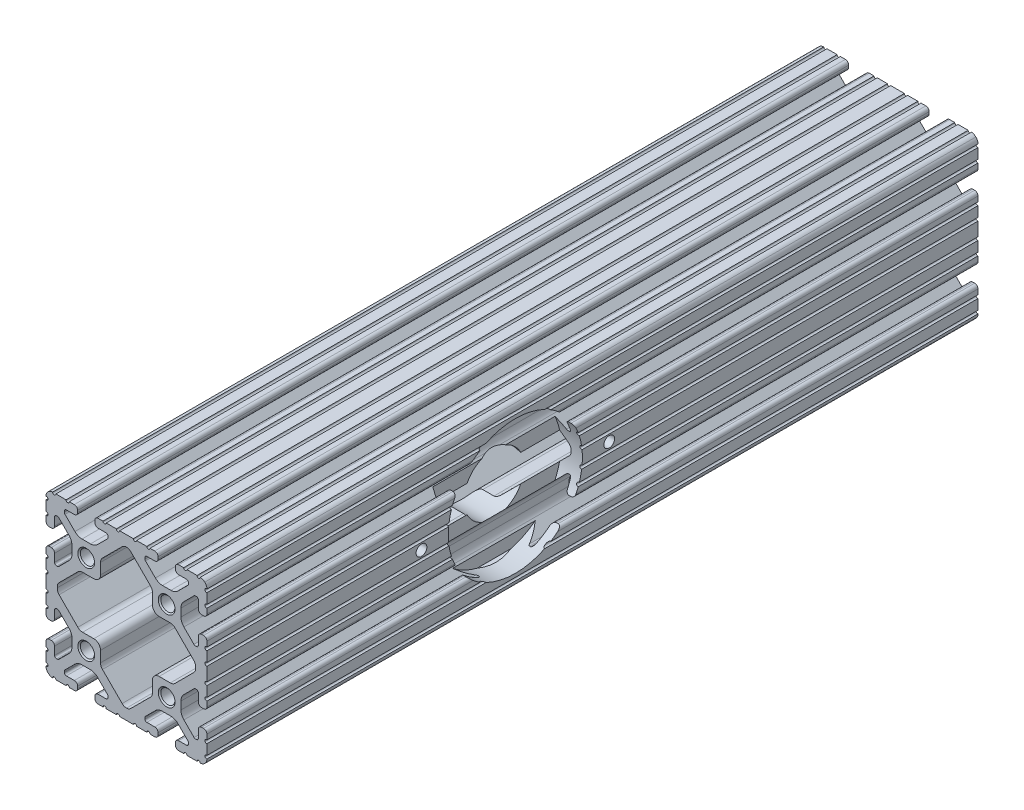
from build123d import *

# Parameters (mm, degrees)
SKETCH1_R                          = 3.3274
BOSS_EXTRUDE1_DEPTH                = 365.125
SKETCH2_R                          = 31.75
CUT_EXTRUDE1_DEPTH                 = 10.16
SKETCH3_R                          = 14.25
CUT_EXTRUDE2_DEPTH                 = 268.906799185
SKETCH4_R                          = 31.75
CUT_EXTRUDE3_DEPTH                 = 10.16
F_1_4_20_TAPPED_HOLE1_D            = 5.1054
CIRPATTERN1_COUNT                  = 2
F_5_16_18_TAPPED_HOLE1_D           = 6.5278
F_5_16_18_TAPPED_HOLE1_DEPTH       = 20.11
F_5_16_18_TAPPED_HOLE1_CSINK_D     = 7.9375
F_5_16_18_TAPPED_HOLE1_CSINK_ANGLE = 100
F_5_16_18_TAPPED_HOLE1_TIP         = 1.961148974
F_1_4_20_TAPPED_HOLE3_D            = 5.1054
LPATTERN2_COUNT                    = 2
LPATTERN2_PITCH                    = 80.3218612
LPATTERN2_COUNT_DIR2               = 2
LPATTERN2_PITCH_DIR2               = 38.1


with BuildPart() as part:
    # Sketch1 → Boss-Extrude1 (new body)
    with BuildSketch(Plane(origin=(0, 0, -254), x_dir=(-1, 0, 0), z_dir=(0, 0, -1))):
        with BuildLine():
            Line((36.525200182, -23.055396049), (35.610799999, -23.055396049))
            ThreePointArc((35.610799999, -23.055396049), (34.49724824, -23.51664429), (34.035999999, -24.630196049))
            Line((34.035999999, -24.630196049), (34.035999999, -28.448000001))
            ThreePointArc((34.035999999, -28.448000001), (33.775617927, -29.07661793), (33.146999999, -29.337000001))
            Line((33.146999999, -29.337000001), (32.664287243, -29.337000001))
            ThreePointArc((32.664287243, -29.337000001), (32.324081166, -29.269328696), (32.035668541, -29.076617157))
            Line((32.035668541, -29.076617157), (27.197580079, -24.238516795))
            ThreePointArc((27.197580079, -24.238516795), (26.167955878, -22.697572205), (25.806399999, -20.879905136))
            Line((25.806399999, -20.879905136), (25.806399999, -17.220094864))
            ThreePointArc((25.806399999, -17.220094864), (26.167955878, -15.402427795), (27.197580079, -13.861483205))
            Line((27.197580079, -13.861483205), (31.948944539, -9.110107059))
            ThreePointArc((31.948944539, -9.110107059), (32.333417094, -8.853210197), (32.786933647, -8.763000001))
            Line((32.786933647, -8.763000001), (33.060275786, -8.763000001))
            ThreePointArc((33.060275786, -8.763000001), (33.750216993, -9.048783007), (34.035999999, -9.738724214))
            Line((34.035999999, -9.738724214), (34.035999999, -13.469803585))
            ThreePointArc((34.035999999, -13.469803585), (34.497248347, -14.583355602), (35.610800365, -15.044603951))
            Line((35.610800365, -15.044603951), (36.525199999, -15.044603951))
            ThreePointArc((36.525199999, -15.044603951), (37.638751758, -14.58335571), (38.099999999, -13.469803951))
            Line((38.099999999, -13.469803951), (38.099999999, -11.075039291))
            ThreePointArc((38.099999999, -11.075039291), (37.117000249, -10.313517274), (38.099999999, -9.551995256))
            Line((38.099999999, -9.551995256), (38.099999999, -4.723759309))
            ThreePointArc((38.099999999, -4.723759309), (37.117000249, -3.962237291), (38.099999999, -3.200715274))
            Line((38.099999999, -3.200715274), (38.099999999, 3.200715274))
            ThreePointArc((38.099999999, 3.200715274), (37.117000249, 3.962237291), (38.099999999, 4.723759309))
            Line((38.099999999, 4.723759309), (38.099999999, 9.551995254))
            ThreePointArc((38.099999999, 9.551995254), (37.117000249, 10.313517271), (38.099999999, 11.075039288))
            Line((38.099999999, 11.075039288), (38.099999999, 13.469803951))
            ThreePointArc((38.099999999, 13.469803951), (37.638751758, 14.58335571), (36.525199999, 15.044603951))
            Line((36.525199999, 15.044603951), (35.610800365, 15.044603951))
            ThreePointArc((35.610800365, 15.044603951), (34.497248347, 14.583355602), (34.035999999, 13.469803585))
            Line((34.035999999, 13.469803585), (34.035999999, 9.738724211))
            ThreePointArc((34.035999999, 9.738724211), (33.750216993, 9.048783004), (33.060275786, 8.762999999))
            Line((33.060275786, 8.762999999), (32.78693365, 8.762999999))
            ThreePointArc((32.78693365, 8.762999999), (32.333417097, 8.853210195), (31.948944542, 9.110107056))
            Line((31.948944542, 9.110107056), (27.197580079, 13.861483205))
            ThreePointArc((27.197580079, 13.861483205), (26.167955878, 15.402427795), (25.806399999, 17.220094864))
            Line((25.806399999, 17.220094864), (25.806399999, 20.879905136))
            ThreePointArc((25.806399999, 20.879905136), (26.167955878, 22.697572205), (27.19758008, 24.238516796))
            Line((27.19758008, 24.238516796), (32.035668541, 29.076617154))
            ThreePointArc((32.035668541, 29.076617154), (32.324081166, 29.269328694), (32.664287243, 29.336999999))
            Line((32.664287243, 29.336999999), (33.146999999, 29.336999999))
            ThreePointArc((33.146999999, 29.336999999), (33.775617927, 29.076617927), (34.035999999, 28.447999999))
            Line((34.035999999, 28.447999999), (34.035999999, 24.630196049))
            ThreePointArc((34.035999999, 24.630196049), (34.49724824, 23.51664429), (35.610799999, 23.055396049))
            Line((35.610799999, 23.055396049), (36.525200182, 23.055396049))
            ThreePointArc((36.525200182, 23.055396049), (37.638751811, 23.516644237), (38.099999999, 24.630195866))
            Line((38.099999999, 24.630195866), (38.099999999, 27.023826138))
            ThreePointArc((38.099999999, 27.023826138), (37.117780707, 27.7845421), (38.099999999, 28.545258063))
            Line((38.099999999, 28.545258063), (38.099999999, 33.373016026))
            ThreePointArc((38.099999999, 33.373016026), (37.141472622, 34.109236775), (38.1, 34.845457522))
            ThreePointArc((38.1, 34.845457522), (37.837757798, 36.120195039), (37.086123087, 37.182631848))
            ThreePointArc((37.086123087, 37.182631848), (36.106286535, 37.843374412), (34.952681874, 38.099999999))
            ThreePointArc((34.952681874, 38.099999999), (34.190730434, 37.320215334), (33.428778993, 38.099999999))
            Line((33.428778993, 38.099999999), (28.601105934, 38.099999999))
            ThreePointArc((28.601105934, 38.099999999), (27.83915858, 37.320219419), (27.077211226, 38.099999999))
            Line((27.077211226, 38.099999999), (24.688799999, 38.099999999))
            ThreePointArc((24.688799999, 38.099999999), (23.57524824, 37.638751758), (23.113999999, 36.525199999))
            Line((23.113999999, 36.525199999), (23.113999999, 35.610799999))
            ThreePointArc((23.113999999, 35.610799999), (23.57524824, 34.49724824), (24.688799999, 34.035999999))
            Line((24.688799999, 34.035999999), (28.447999999, 34.035999999))
            ThreePointArc((28.447999999, 34.035999999), (29.076617927, 33.775617927), (29.336999999, 33.146999999))
            Line((29.336999999, 33.146999999), (29.336999999, 32.720693457))
            ThreePointArc((29.336999999, 32.720693457), (29.326675076, 32.273872753), (29.100231244, 31.888543625))
            Line((29.100231244, 31.888543625), (24.409287498, 27.19758834))
            ThreePointArc((24.409287498, 27.19758834), (22.868340044, 26.167958113), (21.050667578, 25.806399999))
            Line((21.050667578, 25.806399999), (17.049332422, 25.806399999))
            ThreePointArc((17.049332422, 25.806399999), (15.231659956, 26.167958113), (13.690712502, 27.19758834))
            Line((13.690712502, 27.19758834), (9.023381297, 31.864931026))
            ThreePointArc((9.023381297, 31.864931026), (8.830670885, 32.153343115), (8.762999999, 32.493548181))
            Line((8.762999999, 32.493548181), (8.762999999, 33.146999999))
            ThreePointArc((8.762999999, 33.146999999), (9.02338207, 33.775617927), (9.651999999, 34.035999999))
            Line((9.651999999, 34.035999999), (13.411199999, 34.035999999))
            ThreePointArc((13.411199999, 34.035999999), (14.524751758, 34.49724824), (14.985999999, 35.610799999))
            Line((14.985999999, 35.610799999), (14.985999999, 36.525199999))
            ThreePointArc((14.985999999, 36.525199999), (14.524751758, 37.638751758), (13.411199999, 38.099999999))
            Line((13.411199999, 38.099999999), (11.128867073, 38.099999999))
            ThreePointArc((11.128867073, 38.099999999), (10.367071032, 37.320370692), (9.605274992, 38.099999999))
            Line((9.605274992, 38.099999999), (4.777313068, 38.099999999))
            ThreePointArc((4.777313068, 38.099999999), (4.015517027, 37.320370692), (3.253720987, 38.099999999))
            Line((3.253720987, 38.099999999), (-3.253720989, 38.099999999))
            ThreePointArc((-3.253720989, 38.099999999), (-4.01551703, 37.320370692), (-4.777313071, 38.099999999))
            Line((-4.777313071, 38.099999999), (-9.605274992, 38.099999999))
            ThreePointArc((-9.605274992, 38.099999999), (-10.367071032, 37.320370692), (-11.128867073, 38.099999999))
            Line((-11.128867073, 38.099999999), (-13.411200001, 38.099999999))
            ThreePointArc((-13.411200001, 38.099999999), (-14.52475176, 37.638751758), (-14.986000001, 36.525199999))
            Line((-14.986000001, 36.525199999), (-14.986000001, 35.610799999))
            ThreePointArc((-14.986000001, 35.610799999), (-14.52475176, 34.49724824), (-13.411200001, 34.035999999))
            Line((-13.411200001, 34.035999999), (-9.652000001, 34.035999999))
            ThreePointArc((-9.652000001, 34.035999999), (-9.023382073, 33.775617927), (-8.763000001, 33.146999999))
            Line((-8.763000001, 33.146999999), (-8.763000001, 32.493548178))
            ThreePointArc((-8.763000001, 32.493548178), (-8.830670888, 32.153343112), (-9.0233813, 31.864931023))
            Line((-9.0233813, 31.864931023), (-13.690712502, 27.19758834))
            ThreePointArc((-13.690712502, 27.19758834), (-15.231659956, 26.167958113), (-17.049332422, 25.806399999))
            Line((-17.049332422, 25.806399999), (-21.050667578, 25.806399999))
            ThreePointArc((-21.050667578, 25.806399999), (-22.868340044, 26.167958113), (-24.409287498, 27.19758834))
            Line((-24.409287498, 27.19758834), (-29.100231244, 31.888543625))
            ThreePointArc((-29.100231244, 31.888543625), (-29.326675074, 32.273872748), (-29.337000001, 32.720693446))
            Line((-29.337000001, 32.720693446), (-29.337000001, 33.146999999))
            ThreePointArc((-29.337000001, 33.146999999), (-29.07661793, 33.775617927), (-28.448000001, 34.035999999))
            Line((-28.448000001, 34.035999999), (-24.688800001, 34.035999999))
            ThreePointArc((-24.688800001, 34.035999999), (-23.575248242, 34.49724824), (-23.114000001, 35.610799999))
            Line((-23.114000001, 35.610799999), (-23.114000001, 36.525199999))
            ThreePointArc((-23.114000001, 36.525199999), (-23.575248242, 37.638751758), (-24.688800001, 38.099999999))
            Line((-24.688800001, 38.099999999), (-27.077211226, 38.099999999))
            ThreePointArc((-27.077211226, 38.099999999), (-27.83915858, 37.320219419), (-28.601105934, 38.099999999))
            Line((-28.601105934, 38.099999999), (-33.428778993, 38.099999999))
            ThreePointArc((-33.428778993, 38.099999999), (-34.190730434, 37.320215334), (-34.952681874, 38.099999999))
            ThreePointArc((-34.952681874, 38.099999999), (-36.106286561, 37.843374402), (-37.086123128, 37.18263181))
            ThreePointArc((-37.086123128, 37.18263181), (-37.837757809, 36.120195013), (-38.1, 34.845457522))
            ThreePointArc((-38.1, 34.845457522), (-37.141472622, 34.109236773), (-38.100000001, 33.373016026))
            Line((-38.100000001, 33.373016026), (-38.100000001, 28.545258062))
            ThreePointArc((-38.100000001, 28.545258062), (-37.117780707, 27.7845421), (-38.100000001, 27.023826138))
            Line((-38.100000001, 27.023826138), (-38.100000001, 24.630195866))
            ThreePointArc((-38.100000001, 24.630195866), (-37.638751814, 23.516644237), (-36.525200184, 23.055396049))
            Line((-36.525200184, 23.055396049), (-35.610800001, 23.055396049))
            ThreePointArc((-35.610800001, 23.055396049), (-34.497248242, 23.51664429), (-34.036000001, 24.630196049))
            Line((-34.036000001, 24.630196049), (-34.036000001, 28.447999999))
            ThreePointArc((-34.036000001, 28.447999999), (-33.77561793, 29.076617927), (-33.147000001, 29.336999999))
            Line((-33.147000001, 29.336999999), (-32.664287243, 29.336999999))
            ThreePointArc((-32.664287243, 29.336999999), (-32.324081166, 29.269328694), (-32.035668541, 29.076617154))
            Line((-32.035668541, 29.076617154), (-27.197580082, 24.238516798))
            ThreePointArc((-27.197580082, 24.238516798), (-26.16795588, 22.697572208), (-25.806400001, 20.879905138))
            Line((-25.806400001, 20.879905138), (-25.806400001, 17.220094862))
            ThreePointArc((-25.806400001, 17.220094862), (-26.16795588, 15.402427793), (-27.197580082, 13.861483203))
            Line((-27.197580082, 13.861483203), (-31.948944542, 9.110107056))
            ThreePointArc((-31.948944542, 9.110107056), (-32.333417097, 8.853210195), (-32.78693365, 8.762999999))
            Line((-32.78693365, 8.762999999), (-33.060275789, 8.762999999))
            ThreePointArc((-33.060275789, 8.762999999), (-33.750216996, 9.048783004), (-34.036000001, 9.738724211))
            Line((-34.036000001, 9.738724211), (-34.036000001, 13.469803585))
            ThreePointArc((-34.036000001, 13.469803585), (-34.497248349, 14.583355602), (-35.610800367, 15.044603951))
            Line((-35.610800367, 15.044603951), (-36.525200001, 15.044603951))
            ThreePointArc((-36.525200001, 15.044603951), (-37.63875176, 14.58335571), (-38.100000001, 13.469803951))
            Line((-38.100000001, 13.469803951), (-38.100000001, 11.075039288))
            ThreePointArc((-38.100000001, 11.075039288), (-37.117000249, 10.313517271), (-38.100000001, 9.551995254))
            Line((-38.100000001, 9.551995254), (-38.100000001, 4.723759308))
            ThreePointArc((-38.100000001, 4.723759308), (-37.117000249, 3.962237291), (-38.100000001, 3.200715275))
            Line((-38.100000001, 3.200715275), (-38.100000001, -3.200715275))
            ThreePointArc((-38.100000001, -3.200715275), (-37.117000249, -3.962237291), (-38.100000001, -4.723759308))
            Line((-38.100000001, -4.723759308), (-38.100000001, -9.551995257))
            ThreePointArc((-38.100000001, -9.551995257), (-37.117000249, -10.313517274), (-38.100000001, -11.07503929))
            Line((-38.100000001, -11.07503929), (-38.100000001, -13.469803951))
            ThreePointArc((-38.100000001, -13.469803951), (-37.63875176, -14.58335571), (-36.525200001, -15.044603951))
            Line((-36.525200001, -15.044603951), (-35.610800367, -15.044603951))
            ThreePointArc((-35.610800367, -15.044603951), (-34.497248349, -14.583355602), (-34.036000001, -13.469803585))
            Line((-34.036000001, -13.469803585), (-34.036000001, -9.738724214))
            ThreePointArc((-34.036000001, -9.738724214), (-33.750216996, -9.048783007), (-33.060275789, -8.763000001))
            Line((-33.060275789, -8.763000001), (-32.786933647, -8.763000001))
            ThreePointArc((-32.786933647, -8.763000001), (-32.333417094, -8.853210197), (-31.948944539, -9.110107059))
            Line((-31.948944539, -9.110107059), (-27.197580082, -13.861483203))
            ThreePointArc((-27.197580082, -13.861483203), (-26.16795588, -15.402427793), (-25.806400001, -17.220094862))
            Line((-25.806400001, -17.220094862), (-25.806400001, -20.879905138))
            ThreePointArc((-25.806400001, -20.879905138), (-26.16795588, -22.697572207), (-27.197580082, -24.238516797))
            Line((-27.197580082, -24.238516797), (-32.035668541, -29.076617157))
            ThreePointArc((-32.035668541, -29.076617157), (-32.324081166, -29.269328696), (-32.664287243, -29.337000001))
            Line((-32.664287243, -29.337000001), (-33.147000001, -29.337000001))
            ThreePointArc((-33.147000001, -29.337000001), (-33.77561793, -29.07661793), (-34.036000001, -28.448000001))
            Line((-34.036000001, -28.448000001), (-34.036000001, -24.630196049))
            ThreePointArc((-34.036000001, -24.630196049), (-34.497248242, -23.51664429), (-35.610800001, -23.055396049))
            Line((-35.610800001, -23.055396049), (-36.525200184, -23.055396049))
            ThreePointArc((-36.525200184, -23.055396049), (-37.638751814, -23.516644237), (-38.100000001, -24.630195866))
            Line((-38.100000001, -24.630195866), (-38.100000001, -27.023826138))
            ThreePointArc((-38.100000001, -27.023826138), (-37.117780707, -27.7845421), (-38.100000001, -28.545258062))
            Line((-38.100000001, -28.545258062), (-38.100000001, -33.373016026))
            ThreePointArc((-38.100000001, -33.373016026), (-37.141472622, -34.109236773), (-38.1, -34.845457522))
            ThreePointArc((-38.1, -34.845457522), (-37.83775782, -36.120194987), (-37.086123169, -37.182631771))
            ThreePointArc((-37.086123169, -37.182631771), (-36.106286588, -37.843374393), (-34.952681874, -38.100000001))
            ThreePointArc((-34.952681874, -38.100000001), (-34.190730434, -37.320215336), (-33.428778993, -38.100000001))
            Line((-33.428778993, -38.100000001), (-28.601105934, -38.100000001))
            ThreePointArc((-28.601105934, -38.100000001), (-27.83915858, -37.320219421), (-27.077211226, -38.100000001))
            Line((-27.077211226, -38.100000001), (-24.688800001, -38.100000001))
            ThreePointArc((-24.688800001, -38.100000001), (-23.575248242, -37.63875176), (-23.114000001, -36.525200001))
            Line((-23.114000001, -36.525200001), (-23.114000001, -35.610800001))
            ThreePointArc((-23.114000001, -35.610800001), (-23.575248242, -34.497248242), (-24.688800001, -34.036000001))
            Line((-24.688800001, -34.036000001), (-28.448000001, -34.036000001))
            ThreePointArc((-28.448000001, -34.036000001), (-29.07661793, -33.77561793), (-29.337000001, -33.147000001))
            Line((-29.337000001, -33.147000001), (-29.337000001, -32.720693446))
            ThreePointArc((-29.337000001, -32.720693446), (-29.326675074, -32.273872748), (-29.100231244, -31.888543625))
            Line((-29.100231244, -31.888543625), (-24.409287501, -27.197588343))
            ThreePointArc((-24.409287501, -27.197588343), (-22.868340046, -26.167958116), (-21.050667581, -25.806400001))
            Line((-21.050667581, -25.806400001), (-17.049332419, -25.806400001))
            ThreePointArc((-17.049332419, -25.806400001), (-15.231659954, -26.167958116), (-13.690712499, -27.197588343))
            Line((-13.690712499, -27.197588343), (-9.0233813, -31.864931023))
            ThreePointArc((-9.0233813, -31.864931023), (-8.830670888, -32.153343112), (-8.763000001, -32.493548178))
            Line((-8.763000001, -32.493548178), (-8.763000001, -33.147000001))
            ThreePointArc((-8.763000001, -33.147000001), (-9.023382073, -33.77561793), (-9.652000001, -34.036000001))
            Line((-9.652000001, -34.036000001), (-13.411200001, -34.036000001))
            ThreePointArc((-13.411200001, -34.036000001), (-14.52475176, -34.497248242), (-14.986000001, -35.610800001))
            Line((-14.986000001, -35.610800001), (-14.986000001, -36.525200001))
            ThreePointArc((-14.986000001, -36.525200001), (-14.52475176, -37.63875176), (-13.411200001, -38.100000001))
            Line((-13.411200001, -38.100000001), (-11.128867073, -38.100000001))
            ThreePointArc((-11.128867073, -38.100000001), (-10.367071032, -37.320370694), (-9.605274992, -38.100000001))
            Line((-9.605274992, -38.100000001), (-4.777313071, -38.100000001))
            ThreePointArc((-4.777313071, -38.100000001), (-4.01551703, -37.320370694), (-3.253720989, -38.100000001))
            Line((-3.253720989, -38.100000001), (3.253720987, -38.100000001))
            ThreePointArc((3.253720987, -38.100000001), (4.015517027, -37.320370694), (4.777313068, -38.100000001))
            Line((4.777313068, -38.100000001), (9.605274992, -38.100000001))
            ThreePointArc((9.605274992, -38.100000001), (10.367071032, -37.320370694), (11.128867073, -38.100000001))
            Line((11.128867073, -38.100000001), (13.411199999, -38.100000001))
            ThreePointArc((13.411199999, -38.100000001), (14.524751758, -37.63875176), (14.985999999, -36.525200001))
            Line((14.985999999, -36.525200001), (14.985999999, -35.610800001))
            ThreePointArc((14.985999999, -35.610800001), (14.524751758, -34.497248242), (13.411199999, -34.036000001))
            Line((13.411199999, -34.036000001), (9.651999999, -34.036000001))
            ThreePointArc((9.651999999, -34.036000001), (9.02338207, -33.77561793), (8.762999999, -33.147000001))
            Line((8.762999999, -33.147000001), (8.762999999, -32.493548181))
            ThreePointArc((8.762999999, -32.493548181), (8.830670885, -32.153343115), (9.023381297, -31.864931026))
            Line((9.023381297, -31.864931026), (13.690712499, -27.197588343))
            ThreePointArc((13.690712499, -27.197588343), (15.231659954, -26.167958116), (17.049332419, -25.806400001))
            Line((17.049332419, -25.806400001), (21.050667581, -25.806400001))
            ThreePointArc((21.050667581, -25.806400001), (22.868340046, -26.167958116), (24.409287501, -27.197588343))
            Line((24.409287501, -27.197588343), (29.100231244, -31.888543625))
            ThreePointArc((29.100231244, -31.888543625), (29.326675076, -32.273872753), (29.336999999, -32.720693457))
            Line((29.336999999, -32.720693457), (29.336999999, -33.147000001))
            ThreePointArc((29.336999999, -33.147000001), (29.076617927, -33.77561793), (28.447999999, -34.036000001))
            Line((28.447999999, -34.036000001), (24.688799999, -34.036000001))
            ThreePointArc((24.688799999, -34.036000001), (23.57524824, -34.497248242), (23.113999999, -35.610800001))
            Line((23.113999999, -35.610800001), (23.113999999, -36.525200001))
            ThreePointArc((23.113999999, -36.525200001), (23.57524824, -37.63875176), (24.688799999, -38.100000001))
            Line((24.688799999, -38.100000001), (27.077211226, -38.100000001))
            ThreePointArc((27.077211226, -38.100000001), (27.83915858, -37.320219421), (28.601105934, -38.100000001))
            Line((28.601105934, -38.100000001), (33.428778993, -38.100000001))
            ThreePointArc((33.428778993, -38.100000001), (34.190730434, -37.320215336), (34.952681874, -38.100000001))
            ThreePointArc((34.952681874, -38.100000001), (36.106286561, -37.843374403), (37.086123128, -37.182631809))
            ThreePointArc((37.086123128, -37.182631809), (37.837757809, -36.120195013), (38.1, -34.845457522))
            ThreePointArc((38.1, -34.845457522), (37.141472622, -34.109236775), (38.099999999, -33.373016026))
            Line((38.099999999, -33.373016026), (38.099999999, -28.545258063))
            ThreePointArc((38.099999999, -28.545258063), (37.117780707, -27.7845421), (38.099999999, -27.023826138))
            Line((38.099999999, -27.023826138), (38.099999999, -24.630195866))
            ThreePointArc((38.099999999, -24.630195866), (37.638751811, -23.516644237), (36.525200182, -23.055396049))
        make_face()
        with Locations(Location((19.049999999, -19.050000001, 0), (0, 0, 180))):
            Circle(SKETCH1_R, mode=Mode.SUBTRACT)
        with Locations(Location((19.049999999, 19.049999999, 0), (0, 0, 180))):
            Circle(SKETCH1_R, mode=Mode.SUBTRACT)
        with Locations(Location((-19.050000001, 19.049999999, 0), (0, 0, 180))):
            Circle(SKETCH1_R, mode=Mode.SUBTRACT)
        with Locations(Location((-19.050000001, -19.050000001, 0), (0, 0, 180))):
            Circle(SKETCH1_R, mode=Mode.SUBTRACT)
        with BuildLine():
            Line((31.902125566, -2.475607376), (23.014093535, -11.36366127))
            ThreePointArc((23.014093535, -11.36366127), (21.984048445, -12.05191677), (20.769026744, -12.293600001))
            Line((20.769026744, -12.293600001), (15.468599999, -12.293600001))
            ThreePointArc((15.468599999, -12.293600001), (13.223535968, -13.223535971), (12.293599999, -15.468600001))
            Line((12.293599999, -15.468600001), (12.293599999, -20.598259734))
            ThreePointArc((12.293599999, -20.598259734), (12.051918262, -21.813277828), (11.36366679, -22.843321004))
            Line((11.36366679, -22.843321004), (2.051515951, -32.155494748))
            ThreePointArc((2.051515951, -32.155494748), (1.11031328, -32.786013752), (0, -33.011005091))
            ThreePointArc((0, -33.011005091), (-1.11031328, -32.786013752), (-2.051515951, -32.155494748))
            Line((-2.051515951, -32.155494748), (-11.363666793, -22.843321001))
            ThreePointArc((-11.363666793, -22.843321001), (-12.051918264, -21.813277826), (-12.293600001, -20.598259732))
            Line((-12.293600001, -20.598259732), (-12.293600001, -15.468600001))
            ThreePointArc((-12.293600001, -15.468600001), (-13.223535971, -13.223535971), (-15.468600001, -12.293600001))
            Line((-15.468600001, -12.293600001), (-20.769026744, -12.293600001))
            ThreePointArc((-20.769026744, -12.293600001), (-21.984048445, -12.05191677), (-23.014093535, -11.36366127))
            Line((-23.014093535, -11.36366127), (-31.902125566, -2.475607376))
            ThreePointArc((-31.902125566, -2.475607376), (-32.607298578, -1.335259481), (-32.728725173, 0))
            ThreePointArc((-32.728725173, 0), (-32.607298578, 1.335259481), (-31.902125566, 2.475607376))
            Line((-31.902125566, 2.475607376), (-23.014093538, 11.363661268))
            ThreePointArc((-23.014093538, 11.363661268), (-21.984048448, 12.051916767), (-20.769026746, 12.293599999))
            Line((-20.769026746, 12.293599999), (-15.468600001, 12.293599999))
            ThreePointArc((-15.468600001, 12.293599999), (-13.223535971, 13.223535968), (-12.293600001, 15.468599999))
            Line((-12.293600001, 15.468599999), (-12.293600001, 20.598259732))
            ThreePointArc((-12.293600001, 20.598259732), (-12.051918264, 21.813277826), (-11.363666793, 22.843321001))
            Line((-11.363666793, 22.843321001), (-2.051515951, 32.155494748))
            ThreePointArc((-2.051515951, 32.155494748), (-1.11031328, 32.786013752), (0, 33.011005091))
            ThreePointArc((0, 33.011005091), (1.11031328, 32.786013752), (2.051515951, 32.155494748))
            Line((2.051515951, 32.155494748), (11.36366679, 22.843321004))
            ThreePointArc((11.36366679, 22.843321004), (12.051918262, 21.813277828), (12.293599999, 20.598259734))
            Line((12.293599999, 20.598259734), (12.293599999, 15.468599999))
            ThreePointArc((12.293599999, 15.468599999), (13.223535968, 13.223535968), (15.468599999, 12.293599999))
            Line((15.468599999, 12.293599999), (20.769026746, 12.293599999))
            ThreePointArc((20.769026746, 12.293599999), (21.984048448, 12.051916767), (23.014093538, 11.363661268))
            Line((23.014093538, 11.363661268), (31.902125566, 2.475607376))
            ThreePointArc((31.902125566, 2.475607376), (32.607298578, 1.335259481), (32.728725173, 0))
            ThreePointArc((32.728725173, 0), (32.607298578, -1.335259481), (31.902125566, -2.475607376))
        make_face(mode=Mode.SUBTRACT)
    extrude(amount=-BOSS_EXTRUDE1_DEPTH)

    # Sketch2 → Cut-Extrude1 (cut)
    with BuildSketch(Plane.ZY.offset(38.099999999)):
        with Locations((-35.925, -1e-09)):
            Circle(SKETCH2_R)
    extrude(amount=-CUT_EXTRUDE1_DEPTH, mode=Mode.SUBTRACT)

    # Sketch3 → Cut-Extrude2 (cut, through all)
    with BuildSketch(Plane.ZY.offset(38.099999999)):
        with Locations(Location((-34.925, 0, 0), (0, 0, 289.047314681))):
            Circle(SKETCH3_R)
    extrude(amount=-CUT_EXTRUDE2_DEPTH, mode=Mode.SUBTRACT)

    # Sketch4 → Cut-Extrude3 (cut)
    with BuildSketch(Plane(origin=(38.100000001, 0, 0), x_dir=(0, 0, -1), z_dir=(1, 0, 0))):
        with Locations((34.925, 0)):
            Circle(SKETCH4_R)
    extrude(amount=-CUT_EXTRUDE3_DEPTH, mode=Mode.SUBTRACT)

    # 1/4-20 Tapped Hole1 (through all)
    with Locations(Plane(origin=(38.100000001, 0, 0), x_dir=(0, 0, -1), z_dir=(1, 0, 0))):
        with Locations((-9.525, 0)):
            f_1_4_20_tapped_hole1 = Hole(F_1_4_20_TAPPED_HOLE1_D / 2)

    # CirPattern1: 1/4-20 Tapped Hole1 ×2 about axis
    cirpattern1_axis = Axis((0, 0, -34.925), (1, 0, 0))
    for i in range(1, CIRPATTERN1_COUNT):
        add(f_1_4_20_tapped_hole1.rotate(cirpattern1_axis, i * 360 / CIRPATTERN1_COUNT), mode=Mode.SUBTRACT)

    # 5/16-18 Tapped Hole1
    with Locations(Plane.XY.offset(111.125)):
        with Locations((19.050000001, -19.050000001), (-19.049999999, -19.050000001), (-19.049999999, 19.049999999), (19.050000001, 19.049999999)):
            CounterSinkHole(F_5_16_18_TAPPED_HOLE1_D / 2, F_5_16_18_TAPPED_HOLE1_CSINK_D / 2, depth=F_5_16_18_TAPPED_HOLE1_DEPTH, counter_sink_angle=F_5_16_18_TAPPED_HOLE1_CSINK_ANGLE)
            with Locations((0, 0, -(F_5_16_18_TAPPED_HOLE1_DEPTH + F_5_16_18_TAPPED_HOLE1_TIP / 2))):  # 118° drill point
                Cone(0, F_5_16_18_TAPPED_HOLE1_D / 2, F_5_16_18_TAPPED_HOLE1_TIP, mode=Mode.SUBTRACT)

    # 1/4-20 Tapped Hole3 (through all)
    with Locations(Plane(origin=(38.100000001, 0, 0), x_dir=(0, 0, -1), z_dir=(1, 0, 0))):
        with Locations((-5.235926284, 19.05)):
            f_1_4_20_tapped_hole3 = Hole(F_1_4_20_TAPPED_HOLE3_D / 2)

    # LPattern2: 1_4-20 Tapped Hole3 2 × 2
    with Locations(*[(0, -j * LPATTERN2_PITCH_DIR2, -i * LPATTERN2_PITCH) for i in range(LPATTERN2_COUNT) for j in range(LPATTERN2_COUNT_DIR2) if (i, j) != (0, 0)]):
        add(f_1_4_20_tapped_hole3, mode=Mode.SUBTRACT)


solid = part.part
